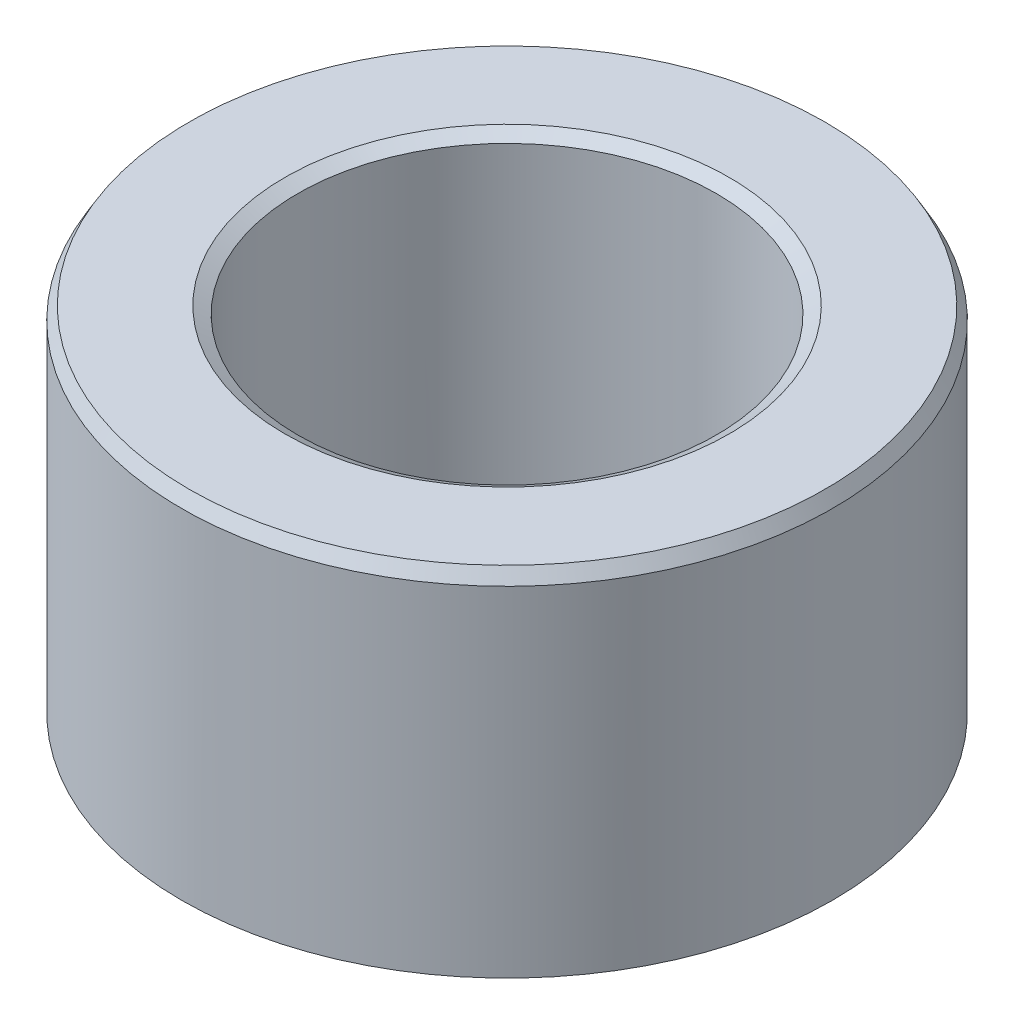
from build123d import *
from OCP.BRepFilletAPI import BRepFilletAPI_MakeChamfer

# Parameters (mm, degrees)
SKETCH1_R           = 30
BOSS_EXTRUDE1_DEPTH = 33.15291752
SKETCH2_R           = 19.286168425
CUT_EXTRUDE1_DEPTH  = 54.843439155
CHAMFER1_SIZE       = 1.192332732
CHAMFER1_SIZE2      = 0.688393624


with BuildPart() as part:
    # Sketch1 → Boss-Extrude1 (new body)
    with BuildSketch(Plane(origin=(0, 0, 0), x_dir=(1, 0, 0), z_dir=(0, 1, 0))):
        Circle(SKETCH1_R)
    extrude(amount=BOSS_EXTRUDE1_DEPTH)

    # Sketch2 → Cut-Extrude1 (cut, through all)
    with BuildSketch(Plane(origin=(0, 0, 0), x_dir=(1, 0, 0), z_dir=(0, 1, 0))):
        Circle(SKETCH2_R)
    extrude(amount=CUT_EXTRUDE1_DEPTH, mode=Mode.SUBTRACT)

    # Chamfer1: one chamfer whose edges measure the first distance from different faces: ONE call of the kernel's chamfer builder (chamfer() names one face for all edges)
    chamfer1_edges_1 = [part.edges().sort_by_distance(p)[0] for p in [
        (-19.286168425, 33.15291752, 0),
    ]]
    chamfer1_side_1 = [part.faces().sort_by_distance(p)[0] for p in [
        (-29.151471863, 33.15291752, 0),
    ]]
    chamfer1_edges_2 = [part.edges().sort_by_distance(p)[0] for p in [
        (-19.286168425, 0, 0),
    ]]
    chamfer1_side_2 = [part.faces().sort_by_distance(p)[0] for p in [
        (-19.286168425, 16.57645876, 0),
    ]]
    chamfer1_edges_3 = [part.edges().sort_by_distance(p)[0] for p in [
        (-30, 0, 0),
    ]]
    chamfer1_side_3 = [part.faces().sort_by_distance(p)[0] for p in [
        (-29.151471863, 0, 0),
    ]]
    chamfer1_edges_4 = [part.edges().sort_by_distance(p)[0] for p in [
        (-30, 33.15291752, 0),
    ]]
    chamfer1_side_4 = [part.faces().sort_by_distance(p)[0] for p in [
        (-30, 16.57645876, 0),
    ]]
    chamfer1 = BRepFilletAPI_MakeChamfer(part.part.solid().wrapped)
    for e in chamfer1_edges_1:
        chamfer1.Add(CHAMFER1_SIZE, CHAMFER1_SIZE2, e.wrapped, chamfer1_side_1[0].wrapped)  # the first distance lies on this face
    for e in chamfer1_edges_2:
        chamfer1.Add(CHAMFER1_SIZE, CHAMFER1_SIZE2, e.wrapped, chamfer1_side_2[0].wrapped)  # the first distance lies on this face
    for e in chamfer1_edges_3:
        chamfer1.Add(CHAMFER1_SIZE, CHAMFER1_SIZE2, e.wrapped, chamfer1_side_3[0].wrapped)  # the first distance lies on this face
    for e in chamfer1_edges_4:
        chamfer1.Add(CHAMFER1_SIZE, CHAMFER1_SIZE2, e.wrapped, chamfer1_side_4[0].wrapped)  # the first distance lies on this face
    add(Compound.cast(chamfer1.Shape()), mode=Mode.REPLACE)


solid = part.part
